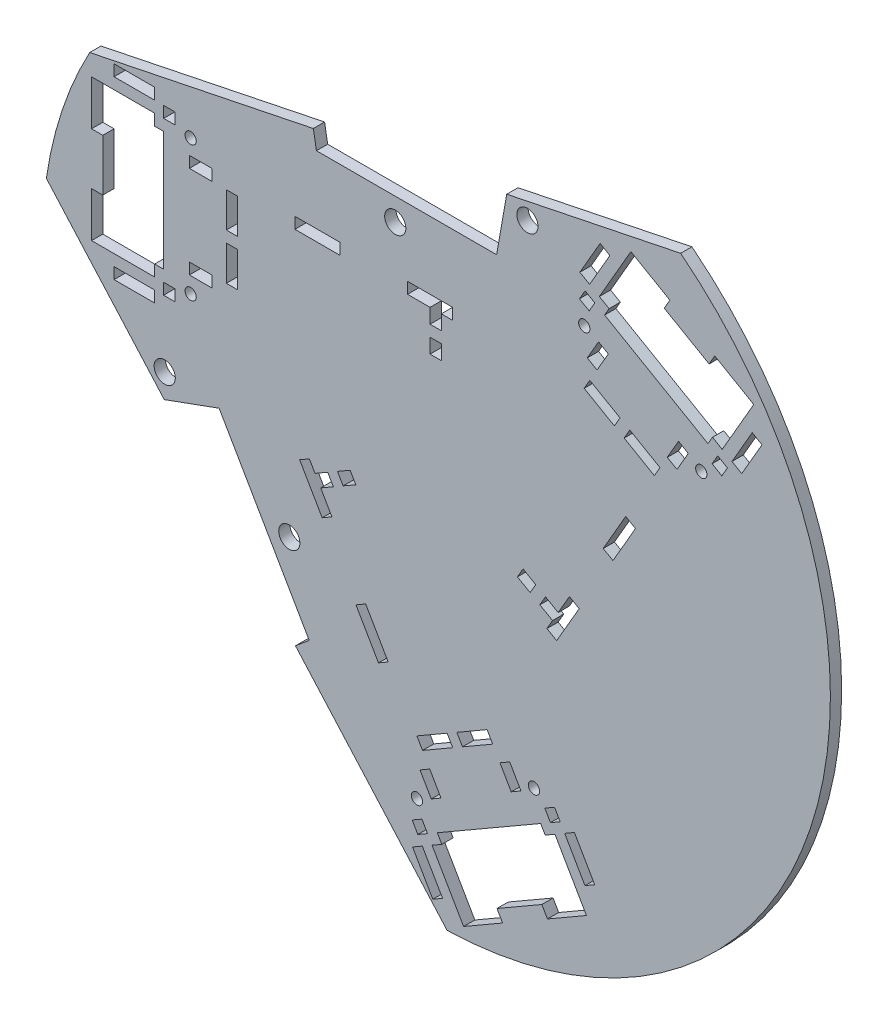
from build123d import *

# Parameters (mm, degrees)
ESQUISSE1_R             = 175
BOSS_EXTRU_1_DEPTH      = 5
ESQUISSE2_W             = 5
ESQUISSE2_H             = 6.5
ESQUISSE2_W_2           = 20
ESQUISSE2_H_2           = 5
ESQUISSE2_H_3           = 15.5
ESQUISSE2_W_3           = 10
ESQUISSE2_W_4           = 18
ESQUISSE2_H_4           = 20
ENL_V_MAT_EXTRU_1_DEPTH = 5
ENL_V_MAT_EXTRU_2_DEPTH = 5
ESQUISSE4_R             = 2.5
ENL_V_MAT_EXTRU_3_DEPTH = 5
ESQUISSE5_R             = 4.7
ENL_V_MAT_EXTRU_4_DEPTH = 5


with BuildPart() as part:
    # Esquisse1 → Boss.-Extru.1 (new body)
    with BuildSketch(Plane.XY):
        with Locations((148.080426897, -12.110171348)):
            Circle(ESQUISSE1_R)
    extrude(amount=BOSS_EXTRU_1_DEPTH)

    # Esquisse2 → Enlèv. mat.-Extru.1 (cut)
    with BuildSketch(Plane(origin=(0, 0, 0), x_dir=(-1, 0, 0), z_dir=(0, 0, -1))):
        Polygon((-155.311788567, 53.777441362), (-135.311788567, 53.777441362), (-135.311788567, 48.777441362), (-145.311788567, 48.777441362), (-145.311788567, 42.277441362), (-150.311788567, 42.277441362), (-150.311788567, 48.777441362), (-155.311788567, 48.777441362), align=None)
        with Locations((-147.811788567, 34.027441362)):
            Rectangle(ESQUISSE2_W, ESQUISSE2_H)
        with Locations((-95.311788567, 51.277441362)):
            Rectangle(ESQUISSE2_W_2, ESQUISSE2_H_2)
        with Locations((-57.36, 41.027441362)):
            Rectangle(ESQUISSE2_W, ESQUISSE2_H_3)
        with Locations((-57.36, 20.527441362)):
            Rectangle(ESQUISSE2_W, ESQUISSE2_H_3)
        with Locations((-43.43, 10.277441362)):
            Rectangle(ESQUISSE2_W_3, ESQUISSE2_H_2)
        with Locations((-29.5, -3.222558638)):
            Rectangle(ESQUISSE2_W, ESQUISSE2_H_2)
        with Locations((-14, -8.222558638)):
            Rectangle(ESQUISSE2_W_4, ESQUISSE2_H_2)
        with Locations((2.5, 9.277441362)):
            Rectangle(ESQUISSE2_W, ESQUISSE2_H_4)
        with Locations((2.5, 52.277441362)):
            Rectangle(ESQUISSE2_W, ESQUISSE2_H_4)
        with Locations((-14, 69.777441362)):
            Rectangle(ESQUISSE2_W_4, ESQUISSE2_H_2)
        with Locations((-29.5, 64.777441362)):
            Rectangle(ESQUISSE2_W, ESQUISSE2_H_2)
        with Locations((-43.43, 51.277441362)):
            Rectangle(ESQUISSE2_W_3, ESQUISSE2_H_2)
        Polygon((-87.404399659, -38.791434793), (-97.404399659, -56.111942869), (-101.734526678, -53.611942869), (-96.734526678, -44.951688831), (-102.363691803, -41.701688831), (-99.863691803, -37.371561812), (-94.234526678, -40.621561812), (-91.734526678, -36.291434793), align=None)
        Polygon((-104.193818822, -34.871561812), (-106.693818822, -39.201688831), (-112.322983946, -35.951688831), (-109.822983946, -31.621561812), align=None)
        Polygon((-112.404399659, -82.092704982), (-122.404399659, -99.413213058), (-126.734526678, -96.913213058), (-116.734526678, -79.592704982), align=None)
        Polygon((-139.460420962, -118.955108529), (-141.960420962, -123.285235548), (-155.38381472, -115.535235548), (-152.88381472, -111.205108529), align=None)
        Polygon((-157.213941739, -108.705108529), (-159.713941739, -113.035235548), (-173.137335498, -105.285235548), (-170.637335498, -100.955108529), align=None)
        Polygon((-176.352335498, -110.853778894), (-181.352335498, -119.514032932), (-185.682462517, -117.014032932), (-180.682462517, -108.353778894), align=None)
        Polygon((-196.258678449, -118.332576278), (-198.758678449, -122.662703297), (-203.088805468, -120.162703297), (-200.588805468, -115.832576278), align=None)
        Polygon((-205.088805468, -123.626804912), (-214.088805468, -139.215262181), (-218.418932487, -136.715262181), (-209.418932487, -121.126804912), align=None)
        Polygon((-212.258678449, -146.045389199), (-214.758678449, -150.375516218), (-197.438170373, -160.375516218), (-194.938170373, -156.045389199), align=None)
        Polygon((-175.019586086, -167.545389199), (-177.519586086, -171.875516218), (-160.199078011, -181.875516218), (-157.699078011, -177.545389199), align=None)
        Polygon((-141.868950992, -160.126804912), (-150.868950992, -175.715262181), (-146.538823973, -178.215262181), (-137.538823973, -162.626804912), align=None)
        Polygon((-139.868950992, -156.662703297), (-137.368950992, -152.332576278), (-141.699078011, -149.832576278), (-144.199078011, -154.162703297), align=None)
        Polygon((-145.845293943, -140.014032932), (-140.845293943, -131.353778894), (-145.175420962, -128.853778894), (-150.175420962, -137.514032932), align=None)
        Polygon((-201.525092463, -51.316520615), (-211.525092463, -33.996012539), (-207.194965444, -31.496012539), (-202.194965444, -40.156266577), (-196.56580032, -36.906266577), (-194.06580032, -41.236393596), (-199.694965444, -44.486393596), (-197.194965444, -48.816520615), align=None)
        Polygon((-189.735673301, -38.736393596), (-192.235673301, -34.406266577), (-186.606508176, -31.156266577), (-184.106508176, -35.486393596), align=None)
        Polygon((-226.525092463, -8.015250425), (-236.525092463, 9.30525765), (-232.194965444, 11.80525765), (-222.194965444, -5.515250425), align=None)
        Polygon((-244.920859728, 33.847153121), (-247.420859728, 38.17728014), (-233.997465969, 45.92728014), (-231.497465969, 41.597153121), align=None)
        Polygon((-227.16733895, 44.097153121), (-229.66733895, 48.42728014), (-216.243945192, 56.17728014), (-213.743945192, 51.847153121), align=None)
        Polygon((-219.458945192, 61.745823487), (-224.458945192, 70.406077524), (-220.128818173, 72.906077524), (-215.128818173, 64.245823487), align=None)
        Polygon((-215.982602241, 82.724620871), (-218.482602241, 87.05474789), (-214.152475222, 89.55474789), (-211.652475222, 85.224620871), align=None)
        Polygon((-216.152475222, 93.018849505), (-225.152475222, 108.607306773), (-220.822348203, 111.107306773), (-211.822348203, 95.518849505), align=None)
        Polygon((-231.982602241, 110.437433792), (-234.482602241, 114.767560811), (-251.803110316, 104.767560811), (-249.303110316, 100.437433792), align=None)
        Polygon((-269.221694603, 88.937433792), (-271.721694603, 93.267560811), (-289.042202679, 83.267560811), (-286.542202679, 78.937433792), align=None)
        Polygon((-279.372329698, 56.518849505), (-288.372329698, 72.107306773), (-292.702456717, 69.607306773), (-283.702456717, 54.018849505), align=None)
        Polygon((-277.372329698, 53.05474789), (-274.872329698, 48.724620871), (-270.542202679, 51.224620871), (-273.042202679, 55.55474789), align=None)
        Polygon((-259.965986747, 49.906077524), (-254.965986747, 41.245823487), (-250.635859728, 43.745823487), (-255.635859728, 52.406077524), align=None)
    extrude(amount=-ENL_V_MAT_EXTRU_1_DEPTH, mode=Mode.SUBTRACT)

    # Esquisse3 → Enlèv. mat.-Extru.2 (cut)
    with BuildSketch(Plane(origin=(0, 0, 0), x_dir=(-1, 0, 0), z_dir=(0, 0, -1))):
        Polygon((0, -0.722558638), (-23, -0.722558638), (-23, 4.277441362), (-27, 4.277441362), (-27, 57.277441362), (-23, 57.277441362), (-23, 62.277441362), (0, 62.277441362), align=None)
        Polygon((-212.258678449, -146.045389199), (-200.758678449, -126.126804912), (-196.42855143, -128.626804912), (-194.42855143, -125.162703297), (-148.52920503, -151.662703297), (-150.52920503, -155.126804912), (-146.199078011, -157.626804912), (-157.699078011, -177.545389199), align=None)
        Polygon((-231.982602241, 110.437433792), (-220.482602241, 90.518849505), (-224.81272926, 88.018849505), (-222.81272926, 84.55474789), (-268.71207566, 58.05474789), (-270.71207566, 61.518849505), (-275.042202679, 59.018849505), (-286.542202679, 78.937433792), align=None)
    extrude(amount=-ENL_V_MAT_EXTRU_2_DEPTH, mode=Mode.SUBTRACT)

    # Esquisse4 → Enlèv. mat.-Extru.3 (cut)
    with BuildSketch(Plane(origin=(0, 0, 0), x_dir=(-1, 0, 0), z_dir=(0, 0, -1))):
        with Locations((-39, 60.777441362)):
            Circle(ESQUISSE4_R)
        with Locations((-39, 0.777441362)):
            Circle(ESQUISSE4_R)
        with Locations((-139.498116116, -143.020398452)):
            Circle(ESQUISSE4_R)
        with Locations((-191.459640343, -113.020398452)):
            Circle(ESQUISSE4_R)
        with Locations((-265.743164573, 45.912443044)):
            Circle(ESQUISSE4_R)
        with Locations((-213.781640346, 75.912443044)):
            Circle(ESQUISSE4_R)
    extrude(amount=-ENL_V_MAT_EXTRU_3_DEPTH, mode=Mode.SUBTRACT)

    # Esquisse5 → Enlèv. mat.-Extru.4 (cut)
    with BuildSketch(Plane(origin=(0, 0, 0), x_dir=(-1, 0, 0), z_dir=(0, 0, -1))):
        with Locations((-188.54080573, 103.777441362)):
            Circle(ESQUISSE5_R)
        with Locations((-129.859999997, 73.777441362)):
            Circle(ESQUISSE5_R)
        with Locations((-27.488620889, -35.014261787)):
            Circle(ESQUISSE5_R)
        with Locations((-82.809785869, -70.833330267)):
            Circle(ESQUISSE5_R)
        Polygon((9.512961524, 70.443622585), (-93.474910733, 91.632672923), (-94.859999997, 83.777441362), (-174.859999997, 83.777441362), (-179.360865983, 109.303120805), (-315.699146075, 137.353789457), (-290.786999001, 258.437508623), (34.425108598, 191.527341751), align=None)
        Polygon((-155.383438382, -189.866946156), (-85.539246378, -111.271357669), (-91.649531831, -106.144219399), (-51.649531831, -36.862187096), (-27.293211991, -45.727162534), (65.168519701, 58.319917207), (157.574022946, -23.796494605), (-62.977935137, -271.983357968), align=None)
    extrude(amount=-ENL_V_MAT_EXTRU_4_DEPTH, mode=Mode.SUBTRACT)


solid = part.part
